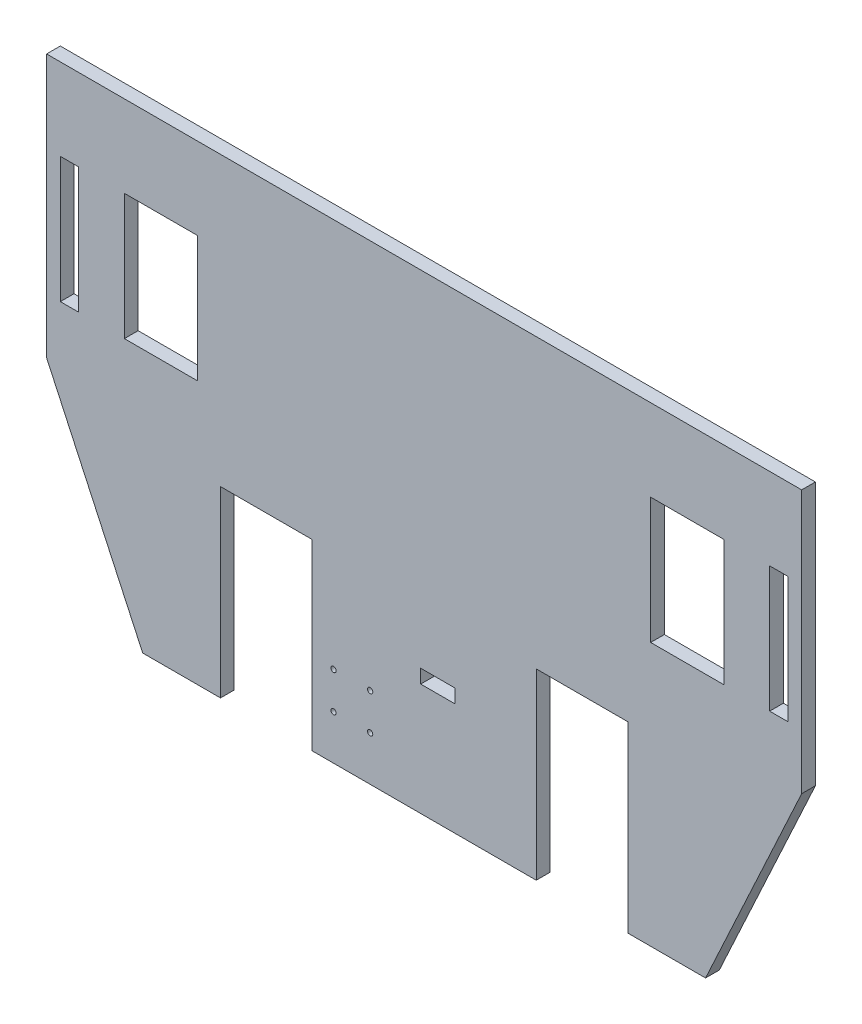
from build123d import *

# Parameters (mm, degrees)
ESQUISSE1_R             = 1.15
ESQUISSE1_W             = 15
ESQUISSE1_H             = 6
BOSS_EXTRU_1_DEPTH      = 6
ESQUISSE2_W             = 8
ESQUISSE2_H             = 55
ESQUISSE2_W_2           = 32
ESQUISSE2_W_3           = 40
ESQUISSE2_H_2           = 80
ENL_V_MAT_EXTRU_1_DEPTH = 6


with BuildPart() as part:
    # Esquisse1 → Boss.-Extru.1 (new body)
    with BuildSketch(Plane.XY):
        Polygon((-165, 96.73), (165, 96.73), (165, -18.27), (123, -109.022410436), (-123, -109.022410436), (-165, -18.27), align=None)
        with Locations((-23.6, -89.522410436)):
            Circle(ESQUISSE1_R, mode=Mode.SUBTRACT)
        with Locations((-23.6, -73.522410436)):
            Circle(ESQUISSE1_R, mode=Mode.SUBTRACT)
        with Locations((-39.6, -89.522410436)):
            Circle(ESQUISSE1_R, mode=Mode.SUBTRACT)
        with Locations((-39.6, -73.522410436)):
            Circle(ESQUISSE1_R, mode=Mode.SUBTRACT)
        with Locations((6, -57.022410436)):
            Rectangle(ESQUISSE1_W, ESQUISSE1_H, mode=Mode.SUBTRACT)
    extrude(amount=BOSS_EXTRU_1_DEPTH)

    # Esquisse2 → Enlèv. mat.-Extru.1 (cut)
    with BuildSketch(Plane.XY.offset(6)):
        with Locations((-155, 33.477589564)):
            Rectangle(ESQUISSE2_W, ESQUISSE2_H)
        with Locations((-115, 33.477589564)):
            Rectangle(ESQUISSE2_W_2, ESQUISSE2_H)
        with Locations((115, 33.477589564)):
            Rectangle(ESQUISSE2_W_2, ESQUISSE2_H)
        with Locations((155, 33.477589564)):
            Rectangle(ESQUISSE2_W, ESQUISSE2_H)
        with Locations((69, -69.022410436)):
            Rectangle(ESQUISSE2_W_3, ESQUISSE2_H_2)
        with Locations((-69, -69.022410436)):
            Rectangle(ESQUISSE2_W_3, ESQUISSE2_H_2)
    extrude(amount=-ENL_V_MAT_EXTRU_1_DEPTH, mode=Mode.SUBTRACT)


solid = part.part
